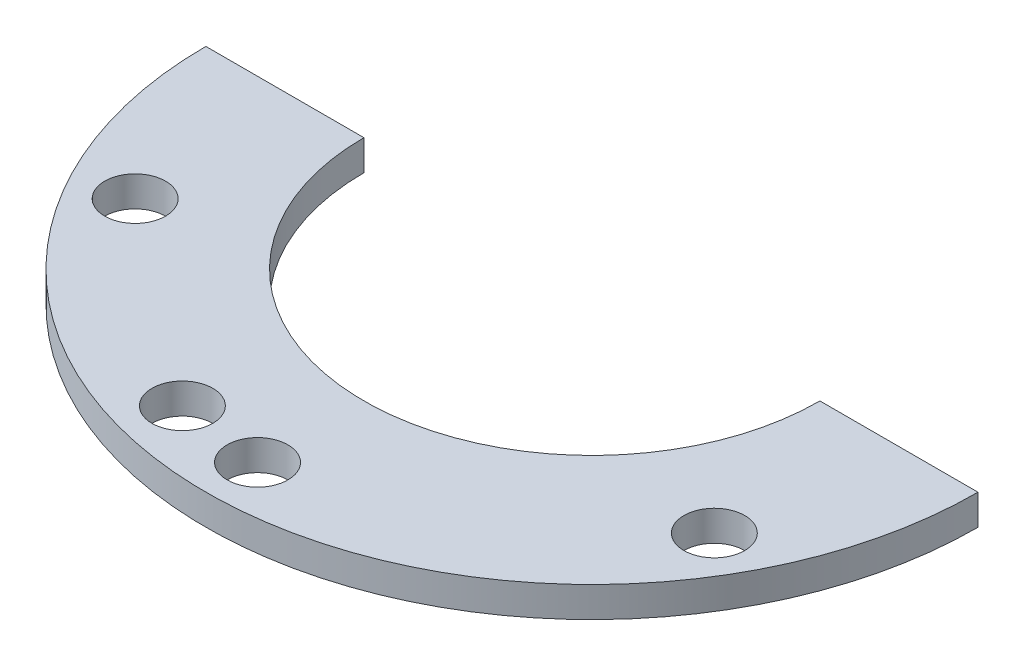
from build123d import *

# Parameters (mm, degrees)
SKETCH1_R               = 12.7
BOSS_EXTRUDE1_DEPTH     = 1
CUT_EXTRUDE1_DEPTH      = 18.98832955
CUT_EXTRUDE1_DEPTH_BACK = 18.98832955
SKETCH19_R              = 1
CUT_EXTRUDE2_DEPTH      = 18.98832955
CUT_EXTRUDE2_DEPTH_BACK = 18.98832955
SKETCH20_R              = 7.5
SKETCH21_W              = 65.874202484
SKETCH21_H              = 51.979273979
CUT_EXTRUDE3_DEPTH      = 18.98832955
CUT_EXTRUDE4_DEPTH      = 18.98832955
CUT_EXTRUDE4_DEPTH_BACK = 18.98832955
SKETCH22_R              = 1


with BuildPart() as part:
    # Sketch1 → Boss-Extrude1 (new body)
    with BuildSketch(Plane(origin=(0, 0, 0), x_dir=(1, 0, 0), z_dir=(0, 1, 0))):
        Circle(SKETCH1_R)
    extrude(amount=BOSS_EXTRUDE1_DEPTH)

    # Sketch19 → Cut-Extrude1 (cut, two sides: drawn at the far end of the back side and taken through both)
    with BuildSketch(Plane(origin=(0, 1, 0), x_dir=(1, 0, 0), z_dir=(0, 1, 0)).offset(-CUT_EXTRUDE1_DEPTH_BACK)):
        with Locations((0, 11)):
            Circle(SKETCH19_R)
        with Locations((9.526279442, 5.5)):
            Circle(SKETCH19_R)
        with Locations((9.526279442, -5.5)):
            Circle(SKETCH19_R)
        with Locations((0, -11)):
            Circle(SKETCH19_R)
        with Locations((-9.526279442, -5.5)):
            Circle(SKETCH19_R)
        with Locations((-9.526279442, 5.5)):
            Circle(SKETCH19_R)
    extrude(amount=CUT_EXTRUDE1_DEPTH + CUT_EXTRUDE1_DEPTH_BACK, mode=Mode.SUBTRACT)

    # Sketch20 → Cut-Extrude2 (cut, two sides: drawn at the far end of the back side and taken through both)
    with BuildSketch(Plane(origin=(0, 1, 0), x_dir=(1, 0, 0), z_dir=(0, 1, 0)).offset(-CUT_EXTRUDE2_DEPTH_BACK)):
        Circle(SKETCH20_R)
    extrude(amount=CUT_EXTRUDE2_DEPTH + CUT_EXTRUDE2_DEPTH_BACK, mode=Mode.SUBTRACT)

    # Sketch21 → Cut-Extrude3 (cut, through all)
    with BuildSketch(Plane.XY):
        with Locations((-3.816154381, 6.321647006)):
            Rectangle(SKETCH21_W, SKETCH21_H)
    extrude(amount=-CUT_EXTRUDE3_DEPTH, mode=Mode.SUBTRACT)

    # Sketch22 → Cut-Extrude4 (cut, two sides: drawn at the far end of the back side and taken through both)
    with BuildSketch(Plane(origin=(0, 1, 0), x_dir=(1, 0, 0), z_dir=(0, 1, 0)).offset(-CUT_EXTRUDE4_DEPTH_BACK)):
        with Locations((-2.847009496, -10.625184089)):
            Circle(SKETCH22_R)
    extrude(amount=CUT_EXTRUDE4_DEPTH + CUT_EXTRUDE4_DEPTH_BACK, mode=Mode.SUBTRACT)


solid = part.part
